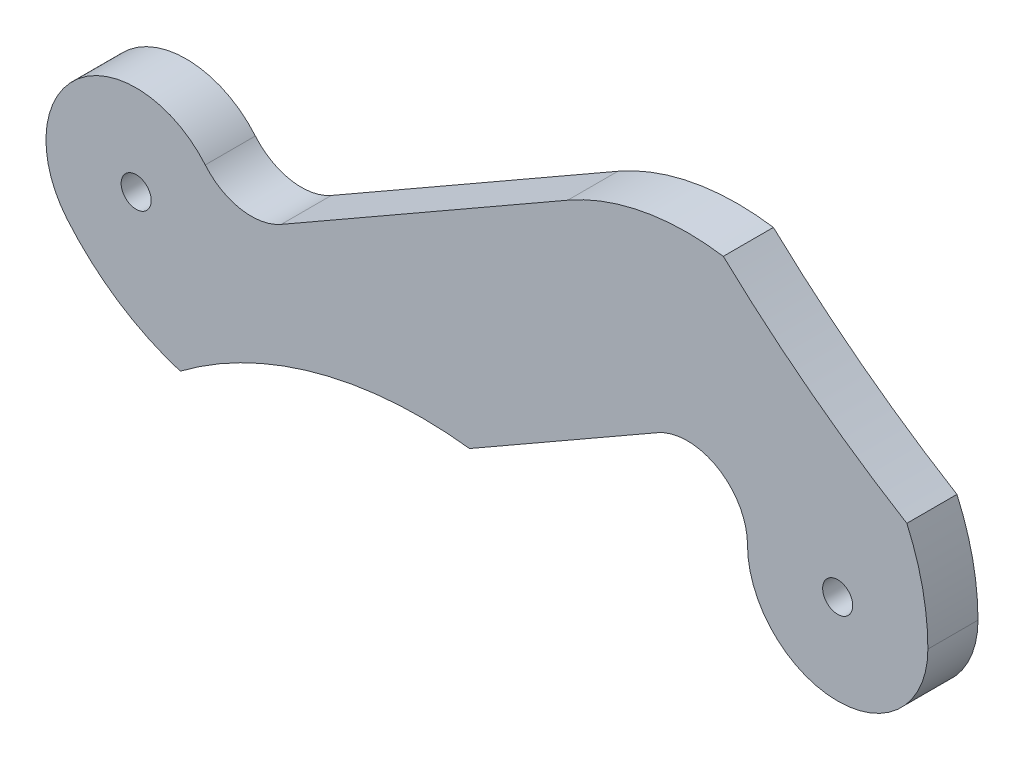
from build123d import *

# Parameters (mm, degrees)
ESQUISSE1_R             = 1.5
BOSS_EXTRU_1_DEPTH      = 5
ENL_V_START             = -10
ENL_V_MAT_EXTRU_1_DEPTH = 10


with BuildPart() as part:
    # Esquisse1 → Boss.-Extru.1 (new body)
    with BuildSketch(Plane.XY):
        with BuildLine():
            Line((14.474115402, 4.43614094), (43.066204977, 20.822692822))
            ThreePointArc((43.066204977, 20.822692822), (67.033056957, 20.765489165), (79, 0))
            ThreePointArc((79, 0), (70, -9), (61, 0))
            ThreePointArc((61, 0), (58.008264239, 5.191372291), (52.016551244, 5.205673206))
            Line((52.016551244, 5.205673206), (23.424461669, -11.180878677))
            ThreePointArc((23.424461669, -11.180878677), (7.285507399, -13.986910655), (-6.894399988, -5.785088487))
            ThreePointArc((-6.894399988, -5.785088487), (-5.785088487, 6.894399988), (6.894399988, 5.785088487))
            ThreePointArc((6.894399988, 5.785088487), (10.439376835, 3.734632945), (14.474115402, 4.43614094))
        make_face()
        with Locations((70, 0)):
            Circle(ESQUISSE1_R, mode=Mode.SUBTRACT)
        Circle(ESQUISSE1_R, mode=Mode.SUBTRACT)
    extrude(amount=BOSS_EXTRU_1_DEPTH)

    # Esquisse2 → Enlèv. mat.-Extru.1 (cut)
    with BuildSketch(Plane.XY.offset(5).offset(ENL_V_START)):
        with BuildLine():
            ThreePointArc((4.401541671, -13.287300689), (18.082976377, -6.617066031), (33.265702076, -5.540717398))
            ThreePointArc((33.265702076, -5.540717398), (20.118574556, -14.201807608), (4.401541671, -13.287300689))
        make_face()
        with BuildLine():
            ThreePointArc((58.58519205, 23.730705804), (67.381451222, 16.298864604), (76.9, 9.817840903))
            ThreePointArc((76.9, 9.817840903), (69.517772071, 19.111103948), (58.58519205, 23.730705804))
        make_face()
    extrude(amount=ENL_V_MAT_EXTRU_1_DEPTH, mode=Mode.SUBTRACT)


solid = part.part
